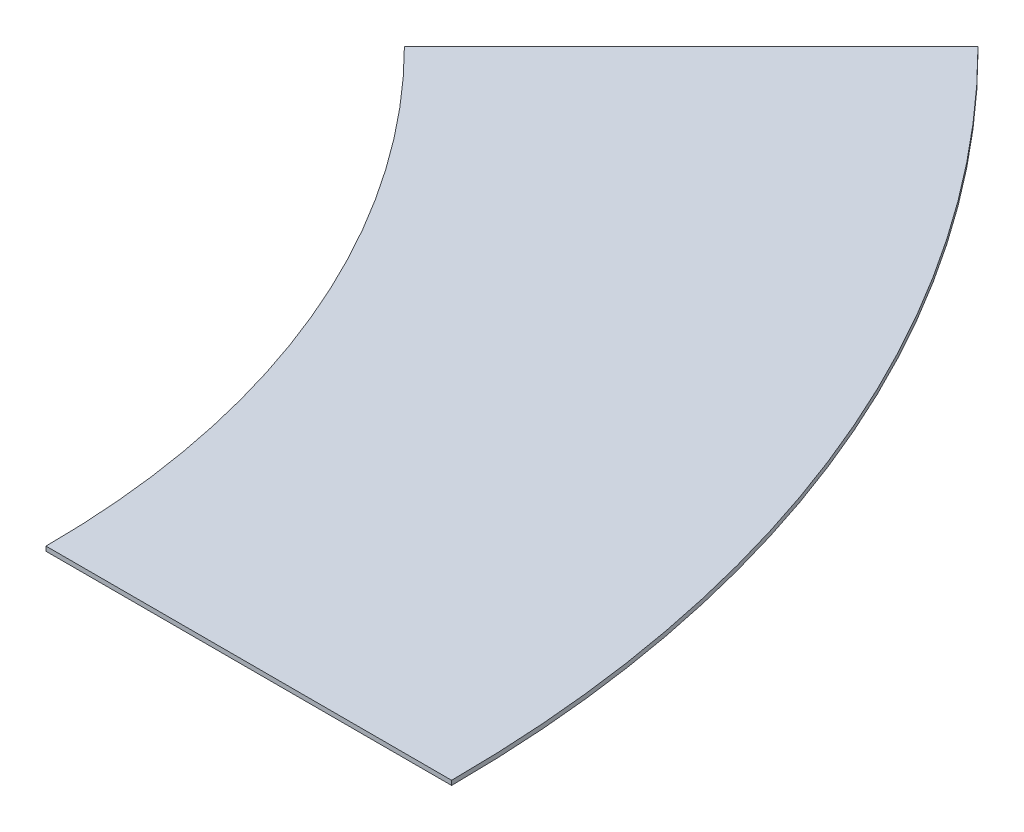
from build123d import *

# Parameters (mm, degrees)
SKETCH2_W      = 450
SKETCH2_H      = 5
REVOLVE1_ANGLE = 45


with BuildPart() as part:
    # Sketch2 → Revolve1 (revolve)
    with BuildSketch(Plane.XY):
        with Locations((1185, 0)):
            Rectangle(SKETCH2_W, SKETCH2_H)
    revolve(axis=Axis((0, 0, 0), (0, 1, 0)), revolution_arc=REVOLVE1_ANGLE)


solid = part.part
